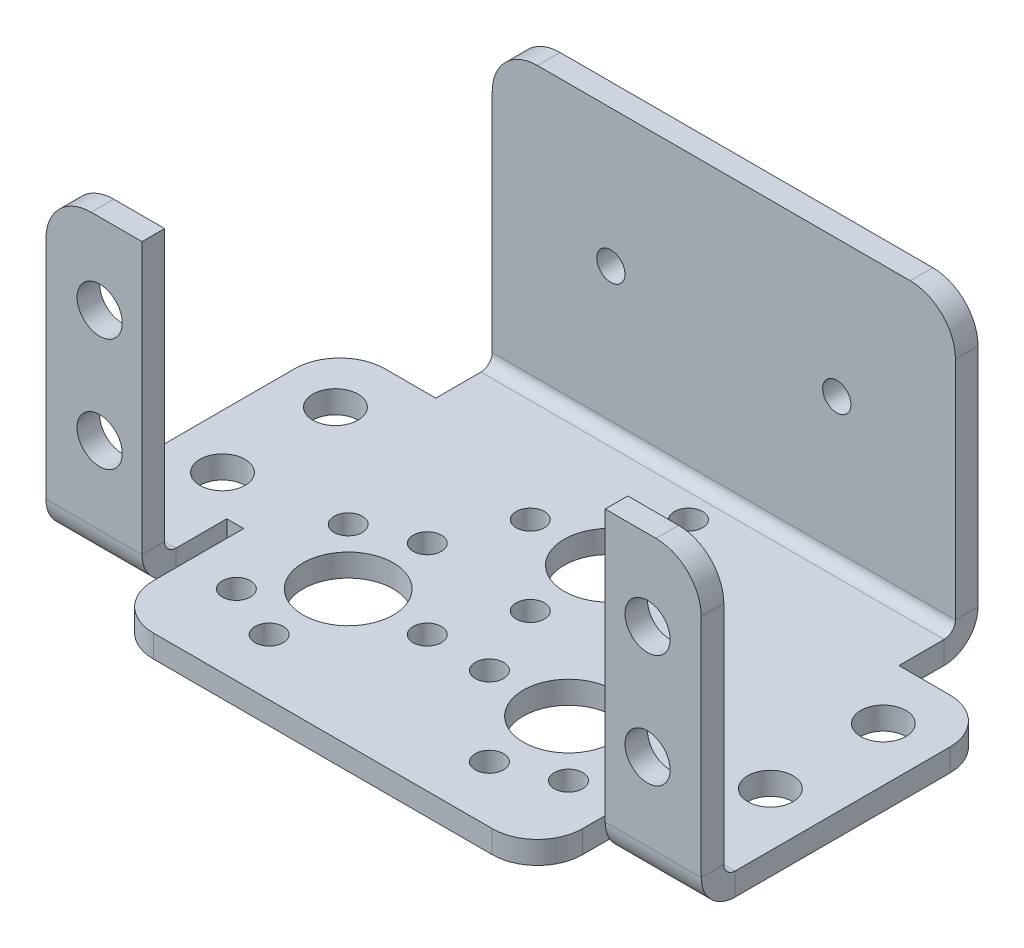
from build123d import *

# Parameters (mm, degrees)
T_LE_DE_BASE_PLI_E1_DEPTH             = 20.5
ESQUISSE8_W                           = 24
ESQUISSE8_H                           = 2
BOSS_EXTRU_1_DEPTH                    = 8.5
T_LE_PLI_E_SUR_AR_TE1_STRIP_W         = 10
T_LE_PLI_E_SUR_AR_TE1_STRIP_H         = 2
T_LE_PLI_E_SUR_AR_TE1_STRIP_CUT_DEPTH = 8.5
T_LE_PLI_E_SUR_AR_TE1_DEPTH           = 8.5
ESQUISSE12_W                          = 1.5
ESQUISSE12_H                          = 12
ENL_V_MAT_EXTRU_1_DEPTH               = 8.5
DIAM_TRE_DU_PER_AGE_4_0_4_1_D         = 4
DIAM_TRE_DU_PER_AGE_8_0_8_1_D         = 8
DIAM_TRE_DU_PER_AGE_2_5_2_5_1_D       = 2.5
R_P_TITION_CIRCULAIRE1_COUNT          = 8
DIAM_TRE_DU_PER_AGE_4_0_4_2_D         = 4
DIAM_TRE_DU_PER_AGE_2_5_2_5_2_D       = 2.5
CONG_1_R                              = 4
DIAM_TRE_DU_PER_AGE_8_0_8_2_D         = 8
DIAM_TRE_DU_PER_AGE_2_5_2_5_3_D       = 2.5
R_P_TITION_CIRCULAIRE2_COUNT          = 4


# Sheet-metal steps are written as plain solids
with BuildPart() as part:
    # Esquisse1 → Tôle de base pliée1 (new body)
    with BuildSketch(Plane(origin=(0, 0, 0), x_dir=(0, 0, -1), z_dir=(1, 0, 0))):
        with BuildLine():
            Line((0, 27), (0, 3))
            ThreePointArc((0, 3), (-0.878679656, 0.878679656), (-3, 0))
            Line((-3, 0), (-37.5, 0))
            Line((-37.5, 0), (-37.5, 2))
            Line((-37.5, 2), (-3, 2))
            ThreePointArc((-3, 2), (-2.292893219, 2.292893219), (-2, 3))
            Line((-2, 3), (-2, 27))
            Line((-2, 27), (0, 27))
        make_face()
    extrude(amount=T_LE_DE_BASE_PLI_E1_DEPTH)

    # Esquisse8 → Boss.-Extru.1 (add)
    with BuildSketch(Plane(origin=(20.5, 0, 0), x_dir=(0, 0, -1), z_dir=(1, 0, 0))):
        with Locations((-19, 1)):
            Rectangle(ESQUISSE8_W, ESQUISSE8_H)
    extrude(amount=BOSS_EXTRU_1_DEPTH)

    # Tôle pliée sur arête1 strip (across the edge) → Tôle pliée sur arête1 strip cut (cut)
    with BuildSketch(Plane(origin=(20.5, 2, 31), x_dir=(0, 0, -1), z_dir=(1, 0, 0))):
        with Locations((-4, -1)):
            Rectangle(T_LE_PLI_E_SUR_AR_TE1_STRIP_W, T_LE_PLI_E_SUR_AR_TE1_STRIP_H)
    extrude(amount=T_LE_PLI_E_SUR_AR_TE1_STRIP_CUT_DEPTH, mode=Mode.SUBTRACT)

    # Tôle pliée sur arête1 section (across the edge) → Tôle pliée sur arête1 (add)
    with BuildSketch(Plane(origin=(20.5, 2, 31), x_dir=(0, 0, -1), z_dir=(1, 0, 0))):
        with BuildLine():
            Line((-2, 1), (-2, 25))
            Line((-2, 25), (0, 25))
            Line((0, 25), (0, 1))
            ThreePointArc((0, 1), (0.292893219, 0.292893219), (1, 0))
            Line((1, 0), (1, -2))
            ThreePointArc((1, -2), (-1.121320344, -1.121320344), (-2, 1))
        make_face()
    extrude(amount=T_LE_PLI_E_SUR_AR_TE1_DEPTH)

    # Esquisse12 → Enlèv. mat.-Extru.1 (cut)
    with BuildSketch(Plane(origin=(0, 2, 0), x_dir=(1, 0, 0), z_dir=(0, 1, 0))):
        with Locations((19.75, -31.5)):
            Rectangle(ESQUISSE12_W, ESQUISSE12_H)
    extrude(amount=-ENL_V_MAT_EXTRU_1_DEPTH, mode=Mode.SUBTRACT)

    # Diamètre du perçage Ø4.0 (4)1 (through all)
    with Locations(Plane(origin=(0, 2, 0), x_dir=(1, 0, 0), z_dir=(0, 1, 0))):
        with Locations((24.25, -12.13), (24.25, -22.13)):
            Hole(DIAM_TRE_DU_PER_AGE_4_0_4_1_D / 2)

    # Diamètre du perçage Ø8.0 (8)1 (through all)
    with Locations(Plane(origin=(0, 2, 0), x_dir=(1, 0, 0), z_dir=(0, 1, 0))):
        with Locations((9.75, -25.5)):
            Hole(DIAM_TRE_DU_PER_AGE_8_0_8_1_D / 2)

    # Diamètre du perçage Ø2.5 (2.5)1 (through all)
    with Locations(Plane(origin=(0, 2, 0), x_dir=(1, 0, 0), z_dir=(0, 1, 0))):
        with Locations((9.75, -18.5)):
            diam_tre_du_per_age_2_5_2_5_1 = Hole(DIAM_TRE_DU_PER_AGE_2_5_2_5_1_D / 2)

    # Répétition circulaire1: Diamètre du perçage Ø2.5 (2.5)1 ×8 about axis, 3 skipped
    r_p_tition_circulaire1_axis = Axis((9.75, 2, 25.5), (0, 1, 0))
    add([diam_tre_du_per_age_2_5_2_5_1.rotate(r_p_tition_circulaire1_axis, i * 360 / R_P_TITION_CIRCULAIRE1_COUNT) for i in range(1, R_P_TITION_CIRCULAIRE1_COUNT) if i not in (1, 3, 6)], mode=Mode.SUBTRACT)

    # Diamètre du perçage Ø4.0 (4)2 (through all)
    with Locations(Plane.XY.offset(33)):
        with Locations((24.25, 19.87), (24.25, 9.87)):
            Hole(DIAM_TRE_DU_PER_AGE_4_0_4_2_D / 2)

    # Diamètre du perçage Ø2.5 (2.5)2 (through all)
    with Locations(Plane.XY.offset(2)):
        with Locations((10, 14.87)):
            Hole(DIAM_TRE_DU_PER_AGE_2_5_2_5_2_D / 2)

    # Congé1
    cong_1_edges = [part.edges().sort_by_distance(p)[0] for p in [
        (20.5, 27, 1),
        (29, 1, 7),
        (29, 27, 32),
        (19, 1, 37.5),
    ]]
    fillet(cong_1_edges, radius=CONG_1_R)

    # Symétrie1: part across plane


with BuildPart() as part_1:
    add(part.part)
    add(part.part.mirror(Plane(origin=(0, 3, 3), x_dir=(0, 0, 1), z_dir=(1, 0, 0))))

    # Diamètre du perçage Ø8.0 (8)2 (through all)
    with Locations(Plane(origin=(0, 2, 0), x_dir=(1, 0, 0), z_dir=(0, 1, 0))):
        with Locations((0, -12.13)):
            Hole(DIAM_TRE_DU_PER_AGE_8_0_8_2_D / 2)

    # Diamètre du perçage Ø2.5 (2.5)3 (through all)
    with Locations(Plane(origin=(0, 2, 0), x_dir=(1, 0, 0), z_dir=(0, 1, 0))):
        with Locations((0, -5.13)):
            diam_tre_du_per_age_2_5_2_5_3 = Hole(DIAM_TRE_DU_PER_AGE_2_5_2_5_3_D / 2)

    # Répétition circulaire2: Diamètre du perçage Ø2.5 (2.5)3 ×4 about axis
    r_p_tition_circulaire2_axis = Axis((0, 0, 12.13), (0, 1, 0))
    for i in range(1, R_P_TITION_CIRCULAIRE2_COUNT):
        add(diam_tre_du_per_age_2_5_2_5_3.rotate(r_p_tition_circulaire2_axis, i * 360 / R_P_TITION_CIRCULAIRE2_COUNT), mode=Mode.SUBTRACT)


solid = part_1.part
